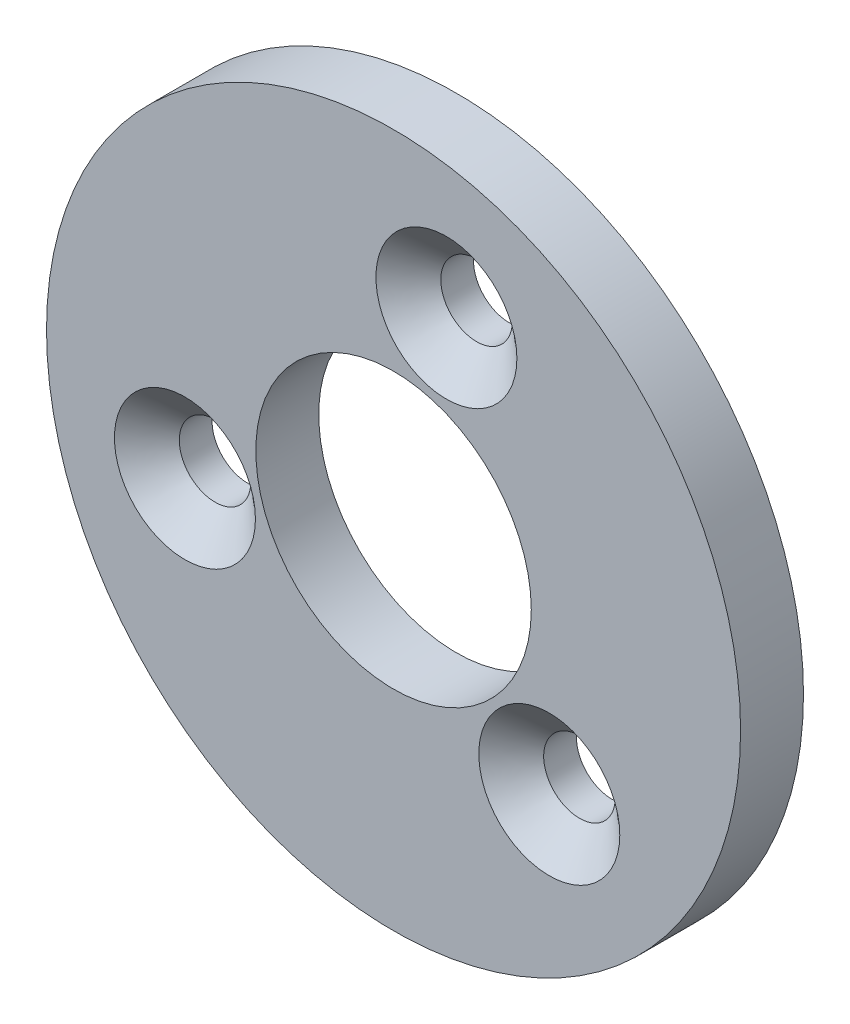
from build123d import *

# Parameters (mm, degrees)
SKETCH1_R           = 16
BOSS_EXTRUDE1_DEPTH = 2.9
SKETCH2_R           = 1.65
CUT_EXTRUDE1_DEPTH  = 23.812496575
CHAMFER1_SIZE       = 1.6
CHAMFER1_SIZE2      = 1.390858781
SKETCH3_R           = 6.35
CUT_EXTRUDE2_DEPTH  = 23.812496575


with BuildPart() as part:
    # Sketch1 → Boss-Extrude1 (new body)
    with BuildSketch(Plane.XY):
        Circle(SKETCH1_R)
    extrude(amount=BOSS_EXTRUDE1_DEPTH)

    # Sketch2 → Cut-Extrude1 (cut, through all)
    with BuildSketch(Plane.XY.offset(2.9)):
        with Locations((-9.61764005, -2.738795333)):
            Circle(SKETCH2_R)
        with Locations((7.180686359, -6.959722941)):
            Circle(SKETCH2_R)
        with Locations((2.436953691, 9.698518274)):
            Circle(SKETCH2_R)
    extrude(amount=-CUT_EXTRUDE1_DEPTH, mode=Mode.SUBTRACT)

    # Chamfer1
    chamfer1_edges = [part.edges().sort_by_distance(p)[0] for p in [
        (-11.26764005, -2.738795333, 2.9),
        (0.786953691, 9.698518274, 2.9),
        (5.530686359, -6.959722941, 2.9),
    ]]
    chamfer1_side = [part.faces().sort_by_distance(p)[0] for p in [
        (0, 0, 2.9),
    ]]
    chamfer(chamfer1_edges, length=CHAMFER1_SIZE, length2=CHAMFER1_SIZE2, reference=chamfer1_side[0])

    # Sketch3 → Cut-Extrude2 (cut, through all)
    with BuildSketch(Plane.XY.offset(2.9)):
        Circle(SKETCH3_R)
    extrude(amount=-CUT_EXTRUDE2_DEPTH, mode=Mode.SUBTRACT)


solid = part.part
